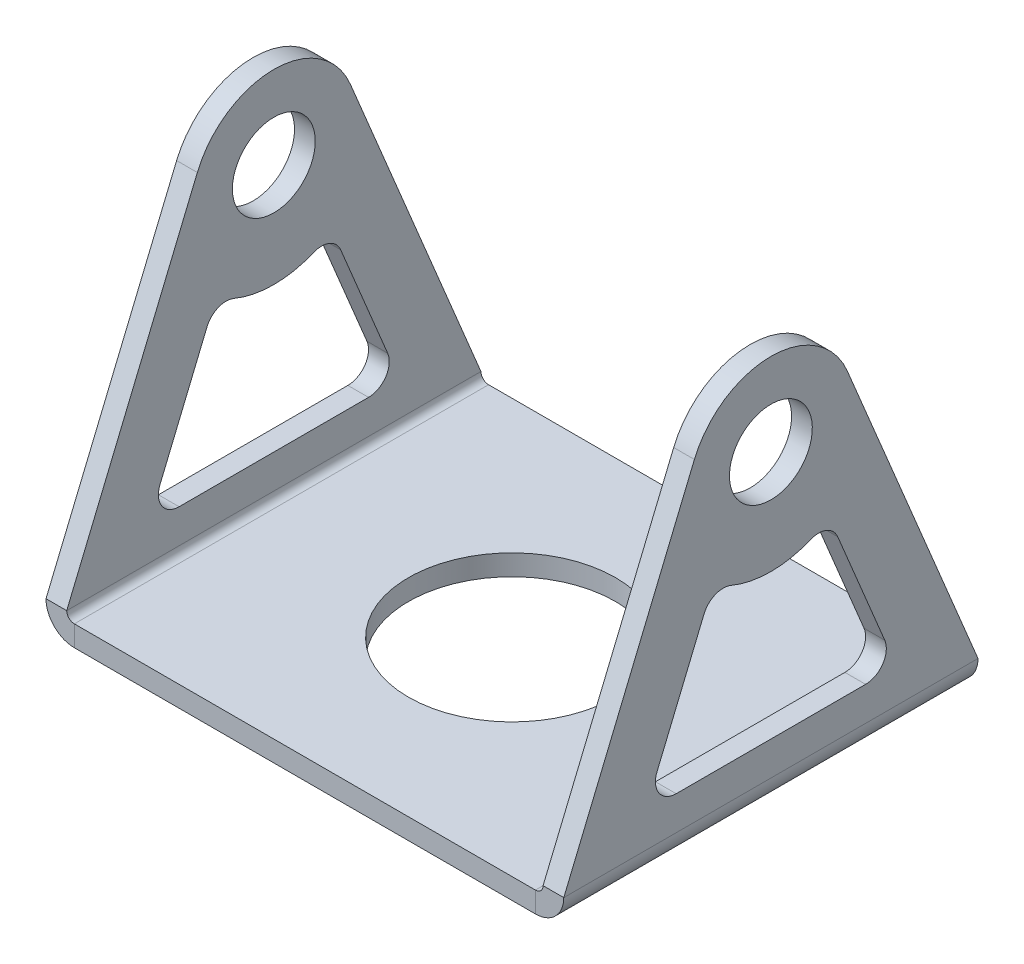
from build123d import *

# Parameters (mm, degrees)
SKETCH1_W                    = 50
SKETCH1_H                    = 40
BASE_FLANGE1_DEPTH           = 2
EDGE_FLANGE1_STRIP_W         = 9.4732
EDGE_FLANGE1_STRIP_H         = 2
EDGE_FLANGE1_STRIP_CUT_DEPTH = 40
EDGE_FLANGE1_DEPTH           = 40
SKETCH14_R                   = 4
CUT_EXTRUDE2_DEPTH           = 10
FILLET1_R                    = 2
FILLET1_OF_MIRROR2_R         = 2
SKETCH23_R                   = 10
CUT_EXTRUDE3_DEPTH           = 10


# Sheet-metal steps are written as plain solids
with BuildPart() as part:
    # Sketch1 → Base-Flange1 (new body)
    with BuildSketch(Plane(origin=(0, 0, 0), x_dir=(1, 0, 0), z_dir=(0, 1, 0))):
        Rectangle(SKETCH1_W, SKETCH1_H)
    extrude(amount=-BASE_FLANGE1_DEPTH)

    # Edge-Flange1 strip (across the edge) → Edge-Flange1 strip cut (cut)
    with BuildSketch(Plane(origin=(-25, 0, -20), x_dir=(1, 0, 0), z_dir=(0, 0, 1))):
        with Locations((-2, -1)):
            Rectangle(EDGE_FLANGE1_STRIP_W, EDGE_FLANGE1_STRIP_H)
    edge_flange1_strip_cut = extrude(amount=EDGE_FLANGE1_STRIP_CUT_DEPTH, mode=Mode.SUBTRACT)

    # Edge-Flange1 section (across the edge) → Edge-Flange1 (add)
    with BuildSketch(Plane(origin=(-25, 0, -20), x_dir=(1, 0, 0), z_dir=(0, 0, 1))):
        with BuildLine():
            Line((0, 0.7366), (0, 36))
            Line((0, 36), (2, 36))
            Line((2, 36), (2, 0.7366))
            ThreePointArc((2, 0.7366), (2.215745145, 0.215745145), (2.7366, 0))
            Line((2.7366, 0), (2.7366, -2))
            ThreePointArc((2.7366, -2), (0.801531583, -1.198468417), (0, 0.7366))
        make_face()
    edge_flange1 = extrude(amount=EDGE_FLANGE1_DEPTH)

    # Sketch14 → Cut-Extrude2 (cut)
    with BuildSketch(Plane.ZY.offset(25)):
        with BuildLine():
            Line((-20, 0.7366), (-7.38689697, 31.071441544))
            ThreePointArc((-7.38689697, 31.071441544), (-4.440071376, 34.654755155), (0, 36))
            Line((0, 36), (-20, 36))
            Line((-20, 36), (-20, 0.7366))
        make_face()
        with BuildLine():
            Line((20, 36), (0, 36))
            ThreePointArc((0, 36), (4.440071376, 34.654755155), (7.38689697, 31.071441544))
            Line((7.38689697, 31.071441544), (20, 0.7366))
            Line((20, 0.7366), (20, 36))
        make_face()
        with BuildLine():
            Line((-5.608456521, 19.720796207), (-12.145099279, 4))
            Line((-12.145099279, 4), (12.145099279, 4))
            Line((12.145099279, 4), (5.608456521, 19.720796207))
            ThreePointArc((5.608456521, 19.720796207), (0, 18), (-5.608456521, 19.720796207))
        make_face()
        with Locations(Location((0, 28, 0), (0, 0, 270))):
            Circle(SKETCH14_R)
    cut_extrude2 = extrude(amount=-CUT_EXTRUDE2_DEPTH, mode=Mode.SUBTRACT)

    # Fillet1
    fillet1_edges = [part.edges().sort_by_distance(p)[0] for p in [
        (-24, 19.720796207, -5.608456521),
        (-24, 19.720796207, 5.608456521),
        (-24, 4, 12.145099279),
        (-24, 4, -12.145099279),
    ]]
    fillet(fillet1_edges, radius=FILLET1_R)

    # Mirror2: Edge-Flange1 strip cut, Edge-Flange1, Cut-Extrude2 across plane
    add(edge_flange1_strip_cut.mirror(Plane(origin=(0, 0, 0), x_dir=(0, 0, 1), z_dir=(1, 0, 0))), mode=Mode.SUBTRACT)
    add(edge_flange1.mirror(Plane(origin=(0, 0, 0), x_dir=(0, 0, 1), z_dir=(1, 0, 0))))
    add(cut_extrude2.mirror(Plane(origin=(0, 0, 0), x_dir=(0, 0, 1), z_dir=(1, 0, 0))), mode=Mode.SUBTRACT)

    # Fillet1 of Mirror2
    fillet1_of_mirror2_edges = [part.edges().sort_by_distance(p)[0] for p in [
        (24, 19.720796207, -5.608456521),
        (24, 19.720796207, 5.608456521),
        (24, 4, 12.145099279),
        (24, 4, -12.145099279),
    ]]
    fillet(fillet1_of_mirror2_edges, radius=FILLET1_OF_MIRROR2_R)

    # Sketch23 → Cut-Extrude3 (cut)
    with BuildSketch(Plane(origin=(0, 0, 0), x_dir=(1, 0, 0), z_dir=(0, 1, 0))):
        with Locations(Location((0, 0, 0), (0, 0, 270))):
            Circle(SKETCH23_R)
    extrude(amount=-CUT_EXTRUDE3_DEPTH, mode=Mode.SUBTRACT)


solid = part.part
